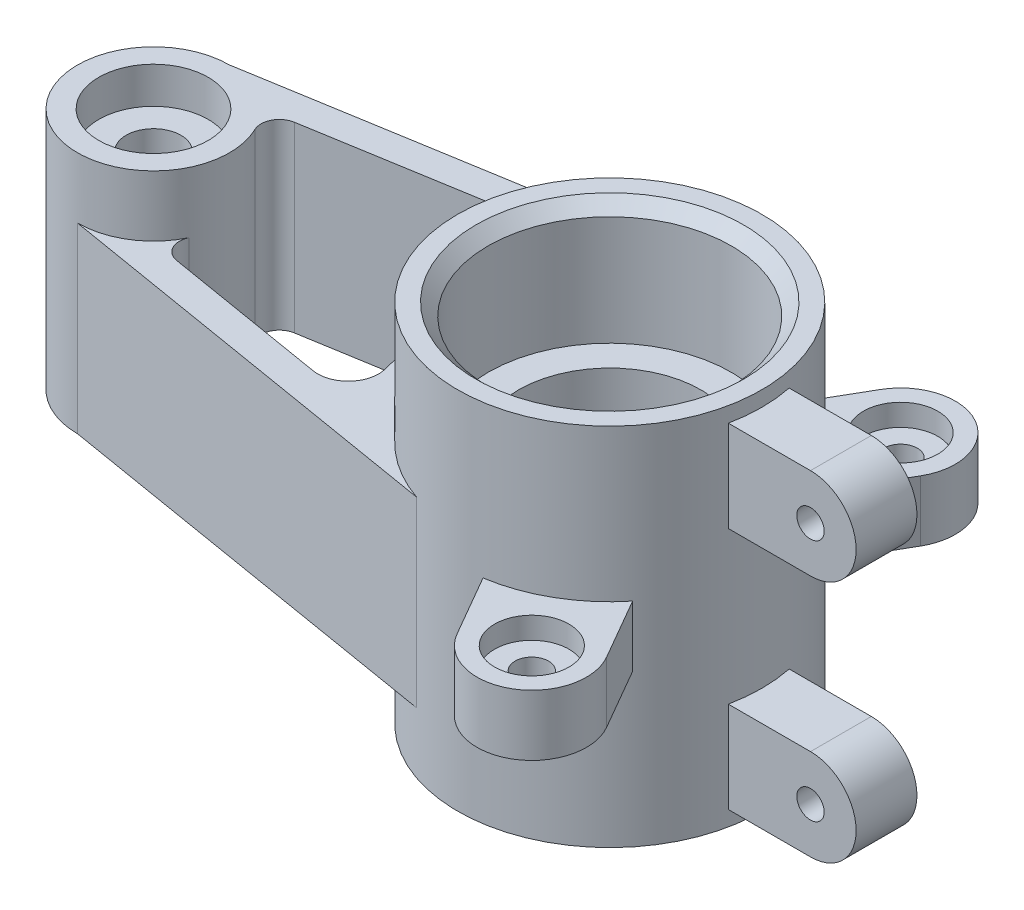
from build123d import *

# Parameters (mm, degrees)
SKETCH3_R                                      = 20
CUT_EXTRUDE1_DEPTH                             = 20
CUT_EXTRUDE2_START                             = -20
SKETCH4_R                                      = 20
CUT_EXTRUDE2_DEPTH                             = 20
SKETCH5_R                                      = 15
CUT_EXTRUDE3_DEPTH                             = 20
CHAMFER1_SIZE                                  = 2
CHAMFER2_SIZE                                  = 2
BOSS_EXTRUDE1_DEPTH                            = 5
CSK_FOR_M4_FLAT_HEAD_MACHINE_SCREW1_AT_2_COUNT = 2
CSK_FOR_M4_FLAT_HEAD_MACHINE_SCREW1_AT_2_PITCH = 40
BOSS_EXTRUDE2_DEPTH                            = 5
CBORE_FOR_M5_HEX_HEAD_BOLT1_AT_2_COUNT         = 2
CBORE_FOR_M5_HEX_HEAD_BOLT1_AT_2_PITCH         = 60.621778265
BOSS_EXTRUDE3_DEPTH                            = 20
CUT_EXTRUDE4_DEPTH                             = 20
CUT_EXTRUDE5_DEPTH                             = 10
CUT_EXTRUDE6_START                             = -10
CUT_EXTRUDE6_DEPTH                             = 10
FILLET1_R                                      = 5


with BuildPart() as part:
    # Sketch1 → Revolve1 (revolve)
    with BuildSketch(Plane.XY):
        Polygon((0, 0), (0, 30), (-25, 30), (-25, -30), (0, -30), align=None)
    revolve(axis=Axis((0, 0, 0), (0, -1, 0)))

    # Sketch3 → Cut-Extrude1 (cut)
    with BuildSketch(Plane(origin=(0, 30, 0), x_dir=(1, 0, 0), z_dir=(0, 1, 0))):
        with Locations(Location((0, 0, 0), (0, 0, 180))):
            Circle(SKETCH3_R)
    extrude(amount=-CUT_EXTRUDE1_DEPTH, mode=Mode.SUBTRACT)

    # Sketch4 → Cut-Extrude2 (cut)
    with BuildSketch(Plane.XZ.offset(30).offset(CUT_EXTRUDE2_START)):
        with Locations(Location((0, 0, 0), (0, 0, 180))):
            Circle(SKETCH4_R)
    extrude(amount=CUT_EXTRUDE2_DEPTH, mode=Mode.SUBTRACT)

    # Sketch5 → Cut-Extrude3 (cut)
    with BuildSketch(Plane(origin=(0, 10, 0), x_dir=(1, 0, 0), z_dir=(0, 1, 0))):
        with Locations(Location((0, 0, 0), (0, 0, 180))):
            Circle(SKETCH5_R)
    extrude(amount=-CUT_EXTRUDE3_DEPTH, mode=Mode.SUBTRACT)

    # Chamfer1
    chamfer1_edges = [part.edges().sort_by_distance(p)[0] for p in [
        (20, -30, 0),
    ]]
    chamfer(chamfer1_edges, length=CHAMFER1_SIZE)

    # Chamfer2
    chamfer2_edges = [part.edges().sort_by_distance(p)[0] for p in [
        (20, 30, 0),
    ]]
    chamfer(chamfer2_edges, length=CHAMFER2_SIZE)

    # Sketch10 → Boss-Extrude1 (add, symmetric)
    with BuildSketch(Plane.XY):
        with BuildLine():
            Line((25, 27.5), (23, 27.5))
            Line((23, 27.5), (23, 12.5))
            Line((23, 12.5), (38, 12.5))
            ThreePointArc((38, 12.5), (45.5, 20), (38, 27.5))
            Line((38, 27.5), (25, 27.5))
        make_face()
        with BuildLine():
            Line((23, -12.5), (38, -12.5))
            ThreePointArc((38, -12.5), (45.5, -20), (38, -27.5))
            Line((38, -27.5), (25, -27.5))
            Line((25, -27.5), (23, -27.5))
            Line((23, -27.5), (23, -12.5))
        make_face()
    extrude(amount=BOSS_EXTRUDE1_DEPTH, both=True)

    # Sketch12 → CSK for M4 Flat Head Machine Screw1 (revolve, cut)
    with BuildSketch(Plane(origin=(38, 20, -5), x_dir=(0, 1, 0), z_dir=(1, 0, 0))):
        Polygon((0, 0), (0, 30), (2.25, 30), (2.25, 2.45), (4.7, 0), align=None)
    csk_for_m4_flat_head_machine_screw1 = revolve(axis=Axis((38, 20, -11.35), (0, 0, 1)), mode=Mode.SUBTRACT)

    # CSK for M4 Flat Head Machine Screw1 at 2: CSK for M4 Flat Head Machine Screw1 ×2
    with Locations(*[(0, -i * CSK_FOR_M4_FLAT_HEAD_MACHINE_SCREW1_AT_2_PITCH, 0) for i in range(1, CSK_FOR_M4_FLAT_HEAD_MACHINE_SCREW1_AT_2_COUNT)]):
        add(csk_for_m4_flat_head_machine_screw1, mode=Mode.SUBTRACT)

    # Sketch13 → Boss-Extrude2 (add, symmetric)
    with BuildSketch(Plane(origin=(0, 0, 0), x_dir=(1, 0, 0), z_dir=(0, 1, 0))):
        with BuildLine():
            Line((9.705771366, 34.810889132), (3.867675156, 24.699009877))
            ThreePointArc((3.867675156, 24.699009877), (12.5, 21.650635095), (19.456132424, 15.699009877))
            Line((19.456132424, 15.699009877), (25.294228634, 25.810889132))
            ThreePointArc((25.294228634, 25.810889132), (22, 38.105117767), (9.705771366, 34.810889132))
        make_face()
        with BuildLine():
            Line((9.705771366, -34.810889132), (3.867675156, -24.699009877))
            ThreePointArc((3.867675156, -24.699009877), (12.5, -21.650635095), (19.456132424, -15.699009877))
            Line((19.456132424, -15.699009877), (25.294228634, -25.810889132))
            ThreePointArc((25.294228634, -25.810889132), (22, -38.105117767), (9.705771366, -34.810889132))
        make_face()
    extrude(amount=BOSS_EXTRUDE2_DEPTH, both=True)

    # Sketch15 → CBORE for M5 Hex Head Bolt1 (revolve, cut)
    with BuildSketch(Plane(origin=(17.5, 5, -30.310889132), x_dir=(0, 0, 1), z_dir=(1, 0, 0))):
        Polygon((0, 0), (0, 35), (2.75, 35), (2.75, 3.58), (6.12, 3.58), (6.12, 0), align=None)
    cbore_for_m5_hex_head_bolt1 = revolve(axis=Axis((17.5, 11.35, -30.310889132), (0, -1, 0)), mode=Mode.SUBTRACT)

    # CBORE for M5 Hex Head Bolt1 at 2: CBORE for M5 Hex Head Bolt1 ×2
    with Locations(*[(0, 0, i * CBORE_FOR_M5_HEX_HEAD_BOLT1_AT_2_PITCH) for i in range(1, CBORE_FOR_M5_HEX_HEAD_BOLT1_AT_2_COUNT)]):
        add(cbore_for_m5_hex_head_bolt1, mode=Mode.SUBTRACT)



with BuildPart() as body_2:
    # Sketch2 → Revolve2 (revolve)
    with BuildSketch(Plane.XY, mode=Mode.PRIVATE) as revolve2_sk:
        Polygon((-75, 0), (-75, 20), (-87.5, 20), (-87.5, -20), (-75, -20), align=None)
    revolve(revolve2_sk.sketch.rotate(Axis((-75, 0, 0), (0, 1, 0)), 270), axis=Axis((-75, 0, 0), (0, 1, 0)))

    # Sketch9 → CBORE for M8 Pan Head Machine Screw2 (revolve, cut)
    with BuildSketch(Plane(origin=(-75, 20, 0), x_dir=(0, 0, 1), z_dir=(1, 0, 0))):
        Polygon((0, 0), (0, 50), (4.5, 50), (4.5, 6), (9, 6), (9, 0), align=None)
    revolve(axis=Axis((-75, 26.35, 0), (0, -1, 0)), mode=Mode.SUBTRACT)


with BuildPart() as part_1:
    add(part.part)

    add(body_2.part)  # Boss-Extrude3 merges body 2
    # Sketch16 → Boss-Extrude3 (add, symmetric)
    with BuildSketch(Plane(origin=(0, 0, 0), x_dir=(1, 0, 0), z_dir=(0, 1, 0))):
        with BuildLine():
            Line((-75, 12.5), (-8.11, 23.647999915))
            ThreePointArc((-8.11, 23.647999915), (-25, 0), (-8.11, -23.647999915))
            Line((-8.11, -23.647999915), (-75, -12.5))
            ThreePointArc((-75, -12.5), (-62.5, 0), (-75, 12.5))
        make_face()
    extrude(amount=BOSS_EXTRUDE3_DEPTH, both=True)

    # Sketch17 → Cut-Extrude4 (cut, symmetric)
    with BuildSketch(Plane(origin=(0, 0, 0), x_dir=(1, 0, 0), z_dir=(0, 1, 0))):
        with BuildLine():
            Line((-34.581559949, -14.167240529), (-61.524552888, -9.676876005))
            ThreePointArc((-61.524552888, -9.676876005), (-63.694159972, -8.0995569), (-63.73497603, -5.41749342))
            ThreePointArc((-63.73497603, -5.41749342), (-62.5, 0), (-63.73497603, 5.41749342))
            ThreePointArc((-63.73497603, 5.41749342), (-63.694159972, 8.0995569), (-61.524552888, 9.676876005))
            Line((-61.524552888, 9.676876005), (-34.581559949, 14.167240529))
            ThreePointArc((-34.581559949, 14.167240529), (-30.048614002, 12.586186956), (-28.936790513, 7.915943077))
            ThreePointArc((-28.936790513, 7.915943077), (-30, 0), (-28.936790513, -7.915943077))
            ThreePointArc((-28.936790513, -7.915943077), (-30.048614002, -12.586186956), (-34.581559949, -14.167240529))
        make_face()
    extrude(amount=CUT_EXTRUDE4_DEPTH, both=True, mode=Mode.SUBTRACT)

    # Sketch18 → Cut-Extrude5 (cut)
    with BuildSketch(Plane(origin=(0, 20, 0), x_dir=(1, 0, 0), z_dir=(0, 1, 0))):
        with BuildLine():
            Line((-30, 0), (-25, 0))
            ThreePointArc((-25, 0), (-20.34391801, -14.530141087), (-8.11, -23.647999915))
            Line((-8.11, -23.647999915), (-75, -12.5))
            ThreePointArc((-75, -12.5), (-68.346755219, -10.582265064), (-63.73497603, -5.41749342))
            ThreePointArc((-63.73497603, -5.41749342), (-63.694159972, -8.0995569), (-61.524552888, -9.676876005))
            Line((-61.524552888, -9.676876005), (-34.581559949, -14.167240529))
            ThreePointArc((-34.581559949, -14.167240529), (-30.048614002, -12.586186956), (-28.936790513, -7.915943077))
            ThreePointArc((-28.936790513, -7.915943077), (-29.733009563, -3.993512527), (-30, 0))
        make_face()
    extrude(amount=-CUT_EXTRUDE5_DEPTH, mode=Mode.SUBTRACT)

    # Sketch19 → Cut-Extrude6 (cut)
    with BuildSketch(Plane.XZ.offset(20).offset(CUT_EXTRUDE6_START)):
        with BuildLine():
            Line((-30, 0), (-25, 0))
            ThreePointArc((-25, 0), (-20.34391801, -14.530141087), (-8.11, -23.647999915))
            Line((-8.11, -23.647999915), (-75, -12.5))
            ThreePointArc((-75, -12.5), (-68.346755219, -10.582265064), (-63.73497603, -5.41749342))
            ThreePointArc((-63.73497603, -5.41749342), (-63.611614037, -8.056719366), (-61.524552888, -9.676876005))
            Line((-61.524552888, -9.676876005), (-33.759588932, -14.235266923))
            ThreePointArc((-33.759588932, -14.235266923), (-29.784880186, -12.268695739), (-28.936790513, -7.915943077))
            ThreePointArc((-28.936790513, -7.915943077), (-29.733009563, -3.993512527), (-30, 0))
        make_face()
    extrude(amount=CUT_EXTRUDE6_DEPTH, mode=Mode.SUBTRACT)

    # Fillet1
    # the kernel refuses this fillet: 5 mm, written as the material it adds along each edge
    with BuildSketch(Plane(origin=(-42.5, 10, 0), x_dir=(0, 0, 1), z_dir=(1, 0, 0))) as fillet1_piece_1_section:
        with BuildLine():
            CenterArc((FILLET1_R, -FILLET1_R), FILLET1_R, 90, 90)
            Line((0, -FILLET1_R), (0, 0))
            Line((0, 0), (FILLET1_R, 0))
        make_face()
    fillet1_piece_1 = extrude(amount=30, mode=Mode.PRIVATE)
    fillet1_piece_1 = fillet1_piece_1 & Plane(origin=(0, 11.115866263, 0), x_dir=(-0.9645596837736771, 0, -0.26386476922549573), z_dir=(0, 1, 0)) * Cylinder(30, 80, mode=Mode.PRIVATE)
    fillet1_piece_1 = fillet1_piece_1 - Plane(origin=(0, 11.115866263, 0), x_dir=(-1, 0, 0), z_dir=(0, 1, 0)) * Cylinder(20, 80, mode=Mode.PRIVATE)
    add(fillet1_piece_1)
    with BuildSketch(Plane(origin=(-42.5, -10, 0), x_dir=(0, 0, -1), z_dir=(1, 0, 0))) as fillet1_piece_2_section:
        with BuildLine():
            CenterArc((FILLET1_R, -FILLET1_R), FILLET1_R, 90, 90)
            Line((0, -FILLET1_R), (0, 0))
            Line((0, 0), (FILLET1_R, 0))
        make_face()
    fillet1_piece_2 = extrude(amount=30, mode=Mode.PRIVATE)
    fillet1_piece_2 = fillet1_piece_2 & Plane(origin=(0, -11.11586543, 0), x_dir=(-0.9645596837736771, 0, -0.26386476922549573), z_dir=(0, 1, 0)) * Cylinder(30, 80, mode=Mode.PRIVATE)
    fillet1_piece_2 = fillet1_piece_2 - Plane(origin=(0, -11.11586543, 0), x_dir=(-1, 0, 0), z_dir=(0, 1, 0)) * Cylinder(20, 80, mode=Mode.PRIVATE)
    add(fillet1_piece_2)
    # the kernel refuses this fillet: 5 mm, written as the material it takes off along each edge
    with BuildSketch(Plane(origin=(-42.5, 20, 0), x_dir=(0, -1, 0), z_dir=(1, 0, 0))) as fillet1_2_piece_1_section:
        with BuildLine():
            CenterArc((FILLET1_R, FILLET1_R), FILLET1_R, 180, 90)
            Line((0, FILLET1_R), (0, 0))
            Line((0, 0), (FILLET1_R, 0))
        make_face()
    fillet1_2_piece_1 = extrude(amount=30, mode=Mode.PRIVATE)
    fillet1_2_piece_1 = fillet1_2_piece_1 - Plane(origin=(0, 18.884144213, 0), x_dir=(-1, 0, 0), z_dir=(0, -1, 0)) * Cylinder(25, 80, mode=Mode.PRIVATE)
    add(fillet1_2_piece_1, mode=Mode.SUBTRACT)
    with BuildSketch(Plane(origin=(-42.5, -20, 0), x_dir=(0, 0, 1), z_dir=(1, 0, 0))) as fillet1_2_piece_2_section:
        with BuildLine():
            CenterArc((FILLET1_R, -FILLET1_R), FILLET1_R, 90, 90)
            Line((0, -FILLET1_R), (0, 0))
            Line((0, 0), (FILLET1_R, 0))
        make_face()
    fillet1_2_piece_2 = extrude(amount=30, mode=Mode.PRIVATE)
    fillet1_2_piece_2 = fillet1_2_piece_2 - Plane(origin=(0, -18.884130023, 0), x_dir=(-1, 0, 0), z_dir=(0, -1, 0)) * Cylinder(25, 80, mode=Mode.PRIVATE)
    add(fillet1_2_piece_2, mode=Mode.SUBTRACT)


solid = part_1.part
